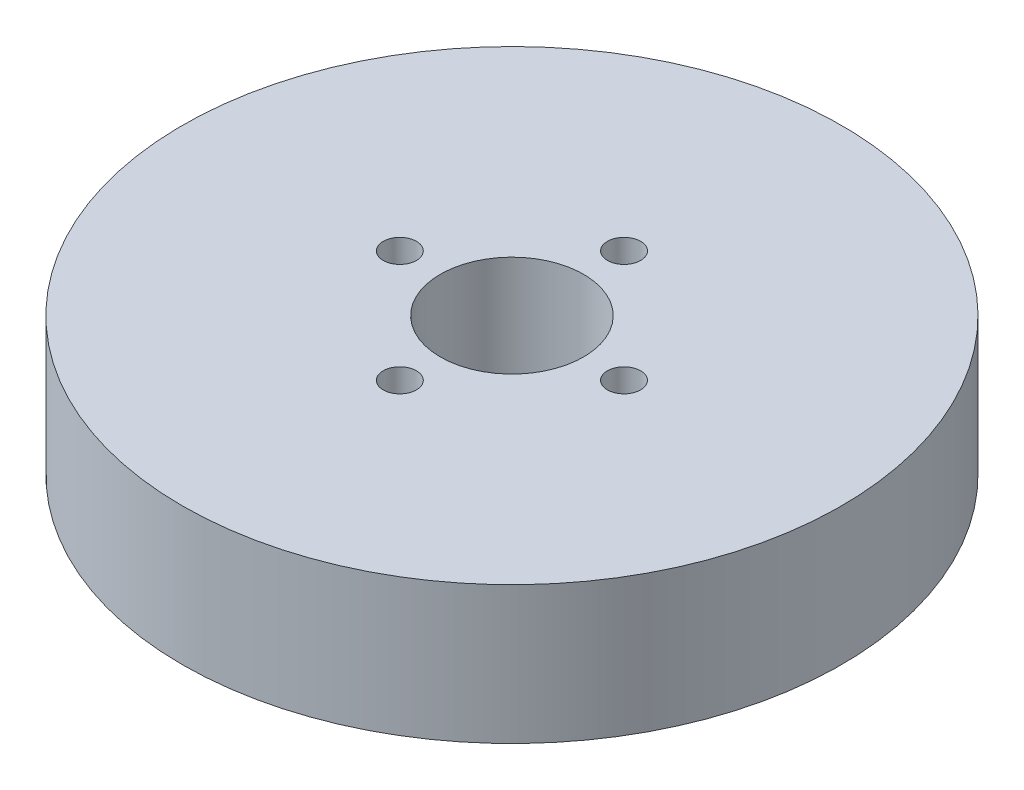
from build123d import *

# Parameters (mm, degrees)
SKETCH1_R           = 57.5
BOSS_EXTRUDE1_DEPTH = 24
SKETCH2_R           = 12.5
CUT_EXTRUDE1_DEPTH  = 85.785022262
SKETCH3_R           = 2.896866408
CUT_EXTRUDE2_DEPTH  = 19.098326655
CIRPATTERN1_COUNT   = 4


with BuildPart() as part:
    # Sketch1 → Boss-Extrude1 (new body)
    with BuildSketch(Plane(origin=(0, 0, 0), x_dir=(1, 0, 0), z_dir=(0, 1, 0))):
        Circle(SKETCH1_R)
    extrude(amount=BOSS_EXTRUDE1_DEPTH)

    # Sketch2 → Cut-Extrude1 (cut, through all)
    with BuildSketch(Plane(origin=(0, 0, 0), x_dir=(1, 0, 0), z_dir=(0, 1, 0))):
        Circle(SKETCH2_R)
    extrude(amount=CUT_EXTRUDE1_DEPTH, mode=Mode.SUBTRACT)

    # Sketch3 → Cut-Extrude2 (cut)
    with BuildSketch(Plane(origin=(0, 24, 0), x_dir=(1, 0, 0), z_dir=(0, 1, 0))):
        with Locations((-19.55893437, 0)):
            Circle(SKETCH3_R)
    cut_extrude2 = extrude(amount=-CUT_EXTRUDE2_DEPTH, mode=Mode.SUBTRACT)

    # CirPattern1: Cut-Extrude2 ×4 about axis
    cirpattern1_axis = Axis((0, 0, 0), (0, 1, 0))
    for i in range(1, CIRPATTERN1_COUNT):
        add(cut_extrude2.rotate(cirpattern1_axis, i * 360 / CIRPATTERN1_COUNT), mode=Mode.SUBTRACT)


solid = part.part
